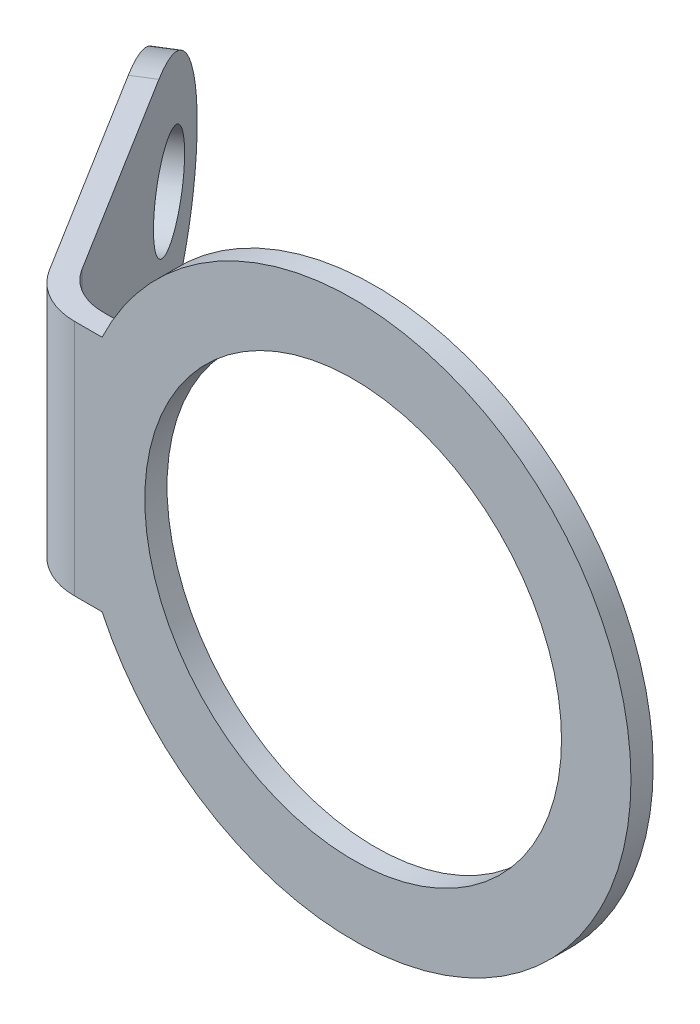
from build123d import *

# Parameters (mm, degrees)
SKETCH1_R                           = 6.35
SKETCH1_R_2                         = 4.7625
EXTRUDE1_DEPTH                      = 0.508
EXTRUDE2_DEPTH                      = 2.7178
EXTRUDE2_DEPTH_BACK                 = 2.7178
SKETCH3_W                           = 0.611005039
SKETCH3_H                           = 5.4356
EXTRUDE3_DEPTH                      = 0.508
FILLET1_R                           = 1.27
FILLET2_R                           = 1.524
FILLET3_R                           = 2.7178
F_1_32_0_03125_DIAMETER_HOLE1_D     = 2.2098
F_1_32_0_03125_DIAMETER_HOLE1_DEPTH = 6.35


with BuildPart() as part:
    # Sketch1 → Extrude1 (new body)
    with BuildSketch(Plane.XY):
        Circle(SKETCH1_R)
        Circle(SKETCH1_R_2, mode=Mode.SUBTRACT)
    extrude(amount=EXTRUDE1_DEPTH)



with BuildPart() as body_2:
    # Sketch2 → Extrude2 (new, two sides: drawn at the far end of the back side and taken through both)
    with BuildSketch(Plane(origin=(0, 0, 0), x_dir=(1, 0, 0), z_dir=(0, 1, 0)).offset(-EXTRUDE2_DEPTH_BACK)):
        Polygon((-6.35, -0.508), (-6.35, 0), (-6.935979418, 0), (-11.626998738, 7.554015397), (-12.058556542, 7.286019385), (-7.367537222, -0.267996011), (-7.218495515, -0.508), (-6.935979418, -0.508), align=None)
    extrude(amount=EXTRUDE2_DEPTH + EXTRUDE2_DEPTH_BACK)


with BuildPart() as part_1:
    add(part.part)

    add(body_2.part)  # Extrude3 merges body 2
    # Sketch3 → Extrude3 (add)
    with BuildSketch(Plane.XY.offset(0.508)):
        with Locations((-6.044497481, 0)):
            Rectangle(SKETCH3_W, SKETCH3_H)
    extrude(amount=-EXTRUDE3_DEPTH)

    # Fillet1
    fillet1_edges = [part_1.edges().sort_by_distance(p)[0] for p in [
        (-6.935979418, 0, 0),
    ]]
    fillet(fillet1_edges, radius=FILLET1_R)

    # Fillet2
    fillet2_edges = [part_1.edges().sort_by_distance(p)[0] for p in [
        (-7.218495515, 0, 0.508),
    ]]
    fillet(fillet2_edges, radius=FILLET2_R)

    # Fillet3
    fillet3_edges = [part_1.edges().sort_by_distance(p)[0] for p in [
        (-11.84277764, 2.7178, -7.420017391),
        (-11.84277764, -2.7178, -7.420017391),
    ]]
    fillet(fillet3_edges, radius=FILLET3_R - 0.0001)  # a hair under: the kernel refuses the full size

    # 1/32 (0.03125) Diameter Hole1
    with Locations(Plane(origin=(-11.00440601, 0, -5.588505732), x_dir=(-0.527551203197, 0, -0.849523235707), z_dir=(-0.849523235707, 0, 0.527551203197))):
        with Locations((0, 0)):
            Hole(F_1_32_0_03125_DIAMETER_HOLE1_D / 2, depth=F_1_32_0_03125_DIAMETER_HOLE1_DEPTH)


solid = part_1.part
